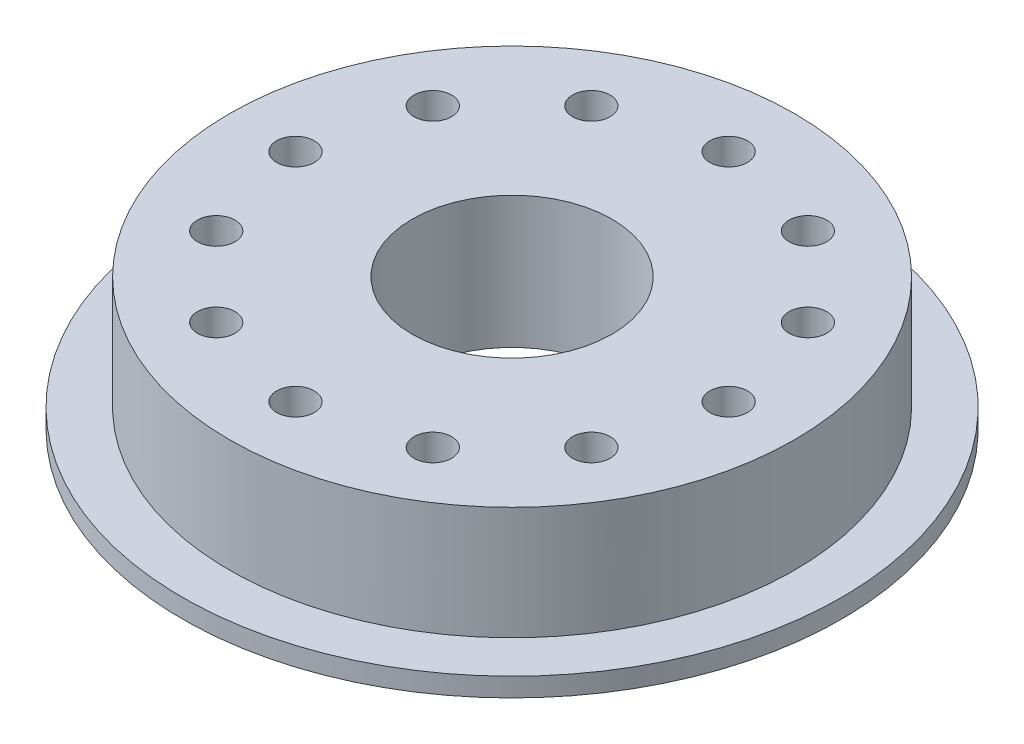
from build123d import *

# Parameters (mm, degrees)
SKETCH1_R           = 30
SKETCH1_R_2         = 10.6
BOSS_EXTRUDE1_DEPTH = 14
SKETCH2_R           = 35
BOSS_EXTRUDE2_DEPTH = 2
CUT_EXTRUDE1_START  = -64
SKETCH3_R           = 10.6
SKETCH3_R_2         = 2
CUT_EXTRUDE1_DEPTH  = 64


with BuildPart() as part:
    # Sketch1 → Boss-Extrude1 (new body)
    with BuildSketch(Plane(origin=(0, 0, 0), x_dir=(1, 0, 0), z_dir=(0, 1, 0))):
        Circle(SKETCH1_R)
        Circle(SKETCH1_R_2, mode=Mode.SUBTRACT)
    extrude(amount=BOSS_EXTRUDE1_DEPTH)

    # Sketch2 → Boss-Extrude2 (add)
    with BuildSketch(Plane.XZ):
        Circle(SKETCH2_R)
    extrude(amount=-BOSS_EXTRUDE2_DEPTH)

    # Sketch3 → Cut-Extrude1 (cut)
    with BuildSketch(Plane(origin=(0, 14, 0), x_dir=(1, 0, 0), z_dir=(0, 1, 0)).offset(CUT_EXTRUDE1_START)):
        Circle(SKETCH3_R)
        with Locations((0, 23)):
            Circle(SKETCH3_R_2)
        with Locations((11.5, 19.918584287)):
            Circle(SKETCH3_R_2)
        with Locations((19.918584287, 11.5)):
            Circle(SKETCH3_R_2)
        with Locations((23, 0)):
            Circle(SKETCH3_R_2)
        with Locations((19.918584287, -11.5)):
            Circle(SKETCH3_R_2)
        with Locations((11.5, -19.918584287)):
            Circle(SKETCH3_R_2)
        with Locations((0, -23)):
            Circle(SKETCH3_R_2)
        with Locations((-11.5, -19.918584287)):
            Circle(SKETCH3_R_2)
        with Locations((-19.918584287, -11.5)):
            Circle(SKETCH3_R_2)
        with Locations((-23, 0)):
            Circle(SKETCH3_R_2)
        with Locations((-19.918584287, 11.5)):
            Circle(SKETCH3_R_2)
        with Locations((-11.5, 19.918584287)):
            Circle(SKETCH3_R_2)
    extrude(amount=CUT_EXTRUDE1_DEPTH, mode=Mode.SUBTRACT)


solid = part.part
